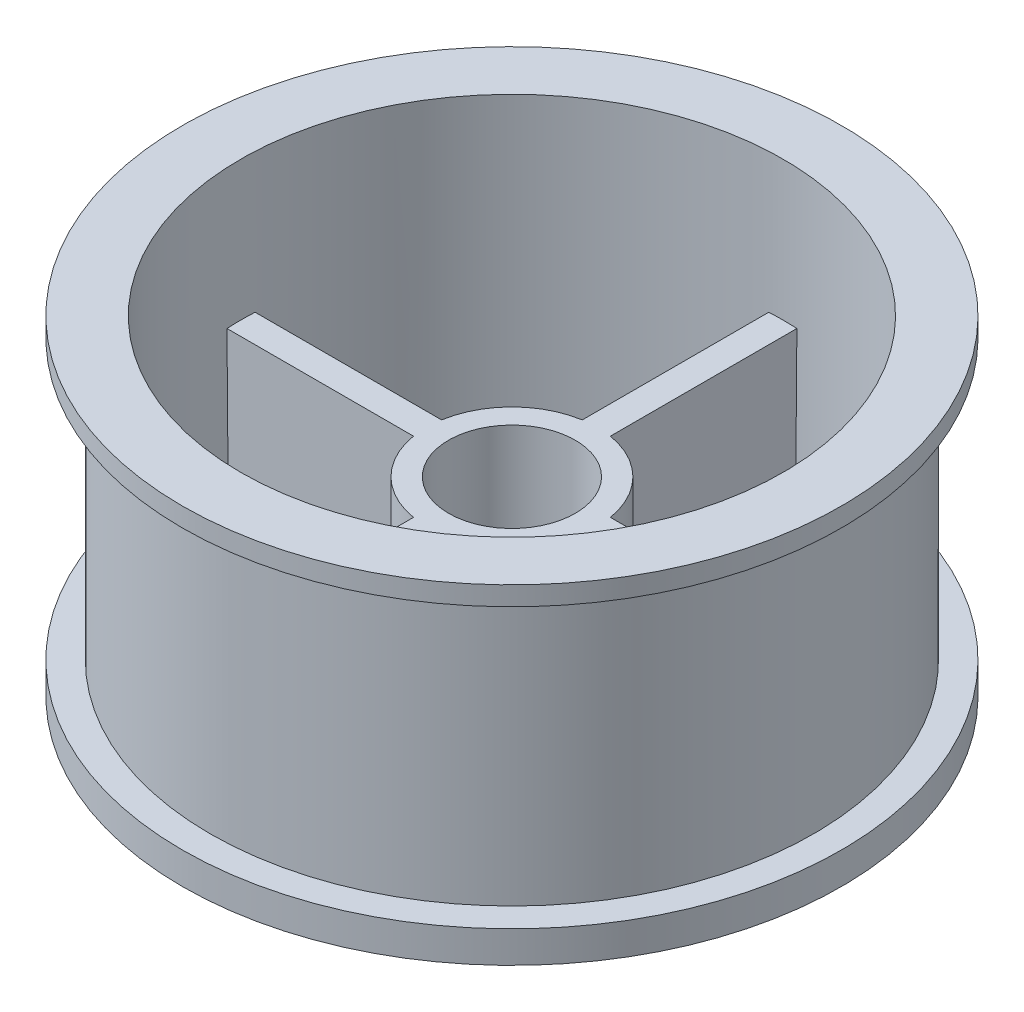
from build123d import *

# Parameters (mm, degrees)
SKETCH3_R           = 6.75
BOSS_EXTRUDE1_DEPTH = 12.5
SKETCH4_R           = 5
CUT_EXTRUDE1_DEPTH  = 10
SKETCH5_R           = 4.25
CUT_EXTRUDE2_DEPTH  = 43.343830719
RIB1_START          = -22
RIB1_DEPTH          = 15.341739823
RIB1_START_2        = 6.658260177
RIB1_2_DEPTH        = 15.341739823
RIB1_3_DEPTH        = 15.341739823
RIB1_4_DEPTH        = 15.341739823
SKETCH9_R           = 6.5
CUT_EXTRUDE3_DEPTH  = 44.637713047


with BuildPart() as part:
    # Sketch2 → Revolve1 (revolve)
    with BuildSketch(Plane(origin=(0, 0, 0), x_dir=(0, 0, -1), z_dir=(1, 0, 0)), mode=Mode.PRIVATE) as revolve1_sk:
        Polygon((0, 0), (26, 0), (26, 2.5), (23.8, 2.5), (23.8, 23.229829408), (26, 24.5), (26, 26), (21.4, 26), (21.4, 2.5), (0, 2.5), align=None)
    revolve(revolve1_sk.sketch.rotate(Axis((0, 2.5, 0), (0, -1, 0)), 180), axis=Axis((0, 2.5, 0), (0, -1, 0)))

    # Sketch3 → Boss-Extrude1 (add)
    with BuildSketch(Plane(origin=(0, 2.5, 0), x_dir=(1, 0, 0), z_dir=(0, 1, 0))):
        with Locations(Location((0, 0, 0), (0, 0, 90))):
            Circle(SKETCH3_R)
    extrude(amount=BOSS_EXTRUDE1_DEPTH)

    # Sketch4 → Cut-Extrude1 (cut)
    with BuildSketch(Plane(origin=(0, 15, 0), x_dir=(1, 0, 0), z_dir=(0, 1, 0))):
        with Locations(Location((0, 0, 0), (0, 0, 270))):
            Circle(SKETCH4_R)
    extrude(amount=-CUT_EXTRUDE1_DEPTH, mode=Mode.SUBTRACT)

    # Sketch5 → Cut-Extrude2 (cut, through all)
    with BuildSketch(Plane(origin=(0, 5, 0), x_dir=(1, 0, 0), z_dir=(0, 1, 0))):
        with Locations(Location((0, 0, 0), (0, 0, 270))):
            Circle(SKETCH5_R)
    extrude(amount=-CUT_EXTRUDE2_DEPTH, mode=Mode.SUBTRACT)

    # Rib1: read off the stored shape, not the designer's step
    # Rib1 outline → Rib1 (add)
    with BuildSketch(Plane.XY.offset(RIB1_START)):
        Polygon((1, 2.5), (1.109085847, 15), (-1.109085847, 15), (-1, 2.5), align=None)
    extrude(amount=RIB1_DEPTH)

    # Rib1 2 outline → Rib1 2 (add)
    with BuildSketch(Plane.XY.offset(RIB1_START_2)):
        Polygon((1, 2.5), (1.109085847, 15), (-1.109085847, 15), (-1, 2.5), align=None)
    extrude(amount=RIB1_2_DEPTH)

    # Rib1 3 outline → Rib1 3 (add)
    with BuildSketch(Plane.YZ.offset(RIB1_START)):
        Polygon((2.5, -1), (15, -1.109085847), (15, 1.109085847), (2.5, 1), align=None)
    extrude(amount=RIB1_3_DEPTH)

    # Rib1 4 outline → Rib1 4 (add)
    with BuildSketch(Plane.YZ.offset(RIB1_START_2)):
        Polygon((2.5, -1), (15, -1.109085847), (15, 1.109085847), (2.5, 1), align=None)
    extrude(amount=RIB1_4_DEPTH)

    # Sketch9 → Cut-Extrude3 (cut, through all)
    with BuildSketch(Plane(origin=(0, 2.5, 0), x_dir=(1, 0, 0), z_dir=(0, 1, 0))):
        with Locations(Location((-9.899494937, 9.899494937, 0), (0, 0, 270))):
            Circle(SKETCH9_R)
        with Locations(Location((9.899494937, -9.899494937, 0), (0, 0, 90))):
            Circle(SKETCH9_R)
        with Locations(Location((9.899494937, 9.899494937, 0), (0, 0, 270))):
            Circle(SKETCH9_R)
        with Locations(Location((-9.899494937, -9.899494937, 0), (0, 0, 90))):
            Circle(SKETCH9_R)
    extrude(amount=-CUT_EXTRUDE3_DEPTH, mode=Mode.SUBTRACT)


solid = part.part
